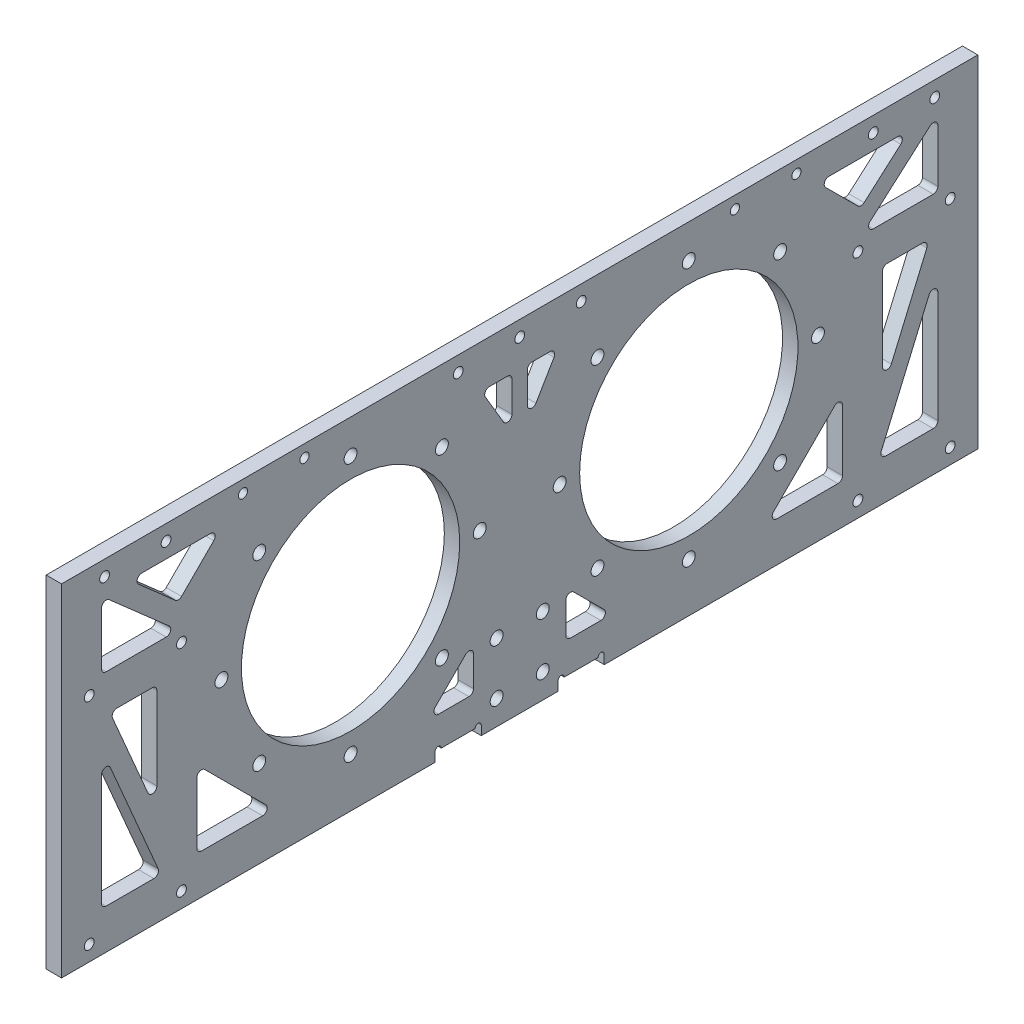
from build123d import *

# Parameters (mm, degrees)
SKETCH_1_W          = 298
SKETCH_1_H          = 111
SKETCH_1_R          = 35.5
SKETCH_1_R_2        = 2.1
SKETCH_1_R_3        = 1.5
EXTRUDE_1_DEPTH     = 5
SKETCH_2_R          = 1.6
CUT_EXTRUDE_1_DEPTH = 213.143819142
SKETCH_3_R          = 1.6
CUT_EXTRUDE_2_DEPTH = 10
CUT_EXTRUDE_3_DEPTH = 213.143819142
CUT_EXTRUDE_4_DEPTH = 213.143819142


with BuildPart() as part:
    # 草图1 → 凸台-拉伸1 (new body)
    with BuildSketch(Plane(origin=(0, 0, 0), x_dir=(0, 0, -1), z_dir=(1, 0, 0))):
        with Locations((55, -2.5)):
            Rectangle(SKETCH_1_W, SKETCH_1_H)
        Circle(SKETCH_1_R, mode=Mode.SUBTRACT)
        with Locations((0, 42)):
            Circle(SKETCH_1_R_2, mode=Mode.SUBTRACT)
        with Locations((110, 42)):
            Circle(SKETCH_1_R_2, mode=Mode.SUBTRACT)
        with Locations((110, 0)):
            Circle(SKETCH_1_R, mode=Mode.SUBTRACT)
        with Locations((62.5, -33)):
            Circle(SKETCH_1_R_2, mode=Mode.SUBTRACT)
        with Locations((47.5, -33)):
            Circle(SKETCH_1_R_2, mode=Mode.SUBTRACT)
        with Locations((47.5, -50)):
            Circle(SKETCH_1_R_2, mode=Mode.SUBTRACT)
        with Locations((62.5, -50)):
            Circle(SKETCH_1_R_2, mode=Mode.SUBTRACT)
        with Locations((-15, 49)):
            Circle(SKETCH_1_R_3, mode=Mode.SUBTRACT)
        with Locations((-35, 49)):
            Circle(SKETCH_1_R_3, mode=Mode.SUBTRACT)
        with Locations((125, 49)):
            Circle(SKETCH_1_R_3, mode=Mode.SUBTRACT)
        with Locations((145, 49)):
            Circle(SKETCH_1_R_3, mode=Mode.SUBTRACT)
        with Locations((29.69848481, 29.69848481)):
            Circle(SKETCH_1_R_2, mode=Mode.SUBTRACT)
        with Locations((42, 0)):
            Circle(SKETCH_1_R_2, mode=Mode.SUBTRACT)
        with Locations((29.69848481, -29.69848481)):
            Circle(SKETCH_1_R_2, mode=Mode.SUBTRACT)
        with Locations((0, -42)):
            Circle(SKETCH_1_R_2, mode=Mode.SUBTRACT)
        with Locations((-29.69848481, -29.69848481)):
            Circle(SKETCH_1_R_2, mode=Mode.SUBTRACT)
        with Locations((-42, 0)):
            Circle(SKETCH_1_R_2, mode=Mode.SUBTRACT)
        with Locations((-29.69848481, 29.69848481)):
            Circle(SKETCH_1_R_2, mode=Mode.SUBTRACT)
        with Locations((139.69848481, 29.69848481)):
            Circle(SKETCH_1_R_2, mode=Mode.SUBTRACT)
        with Locations((152, 0)):
            Circle(SKETCH_1_R_2, mode=Mode.SUBTRACT)
        with Locations((139.69848481, -29.69848481)):
            Circle(SKETCH_1_R_2, mode=Mode.SUBTRACT)
        with Locations((110, -42)):
            Circle(SKETCH_1_R_2, mode=Mode.SUBTRACT)
        with Locations((80.30151519, -29.69848481)):
            Circle(SKETCH_1_R_2, mode=Mode.SUBTRACT)
        with Locations((68, 0)):
            Circle(SKETCH_1_R_2, mode=Mode.SUBTRACT)
        with Locations((80.30151519, 29.69848481)):
            Circle(SKETCH_1_R_2, mode=Mode.SUBTRACT)
    extrude(amount=EXTRUDE_1_DEPTH)

    # 草图2 → 切除-拉伸1 (cut, through all)
    with BuildSketch(Plane(origin=(5, 0, 0), x_dir=(0, 0, -1), z_dir=(1, 0, 0))):
        with Locations((-80, 48)):
            Circle(SKETCH_2_R)
        with Locations((-60, 48)):
            Circle(SKETCH_2_R)
        with Locations((170, 48)):
            Circle(SKETCH_2_R)
        with Locations((190, 48)):
            Circle(SKETCH_2_R)
        with Locations((35, 48)):
            Circle(SKETCH_2_R)
        with Locations((55, 48)):
            Circle(SKETCH_2_R)
        with Locations((75, 48)):
            Circle(SKETCH_2_R)
    extrude(amount=-CUT_EXTRUDE_1_DEPTH, mode=Mode.SUBTRACT)

    # 草图3 → 切除-拉伸2 (cut)
    with BuildSketch(Plane(origin=(5, 0, 0), x_dir=(0, 0, -1), z_dir=(1, 0, 0))):
        with Locations((-85, -53)):
            Circle(SKETCH_3_R)
        with Locations((-55, -53)):
            Circle(SKETCH_3_R)
        with Locations((-85, 17)):
            Circle(SKETCH_3_R)
        with Locations((-55, 17)):
            Circle(SKETCH_3_R)
        with Locations((165, 17)):
            Circle(SKETCH_3_R)
        with Locations((195, 17)):
            Circle(SKETCH_3_R)
        with Locations((165, -53)):
            Circle(SKETCH_3_R)
        with Locations((195, -53)):
            Circle(SKETCH_3_R)
    extrude(amount=-CUT_EXTRUDE_2_DEPTH, mode=Mode.SUBTRACT)

    # 草图4 → 切除-拉伸3 (cut, through all)
    with BuildSketch(Plane(origin=(5, 0, 0), x_dir=(0, 0, -1), z_dir=(1, 0, 0))):
        with BuildLine():
            Line((45.122624964, 39), (51, 39))
            ThreePointArc((51, 39), (52.060660172, 38.560660172), (52.5, 37.5))
            Line((52.5, 37.5), (52.5, 27.508462438))
            ThreePointArc((52.5, 27.508462438), (51.394111669, 26.061162887), (49.707098677, 26.747932249))
            Line((49.707098677, 26.747932249), (43.829723641, 36.73946981))
            ThreePointArc((43.829723641, 36.73946981), (43.820550603, 38.244716293), (45.122624964, 39))
        make_face()
        with BuildLine():
            Line((57.5, 37.5), (57.5, 27.508462438))
            ThreePointArc((57.5, 27.508462438), (58.605888331, 26.061162887), (60.292901323, 26.747932249))
            Line((60.292901323, 26.747932249), (66.170276359, 36.73946981))
            ThreePointArc((66.170276359, 36.73946981), (66.179449397, 38.244716293), (64.877375036, 39))
            Line((64.877375036, 39), (59, 39))
            ThreePointArc((59, 39), (57.939339828, 38.560660172), (57.5, 37.5))
        make_face()
        with BuildLine():
            Line((-81, -7.256992992), (-81, -43.5))
            ThreePointArc((-81, -43.5), (-80.560660172, -44.560660172), (-79.5, -45))
            Line((-79.5, -45), (-63.967282711, -45))
            ThreePointArc((-63.967282711, -45), (-62.715021073, -44.325736513), (-62.588565166, -42.909121052))
            Line((-62.588565166, -42.909121052), (-78.121282455, -6.666114044))
            ThreePointArc((-78.121282455, -6.666114044), (-79.801598808, -5.787626408), (-81, -7.256992992))
        make_face()
        with BuildLine():
            Line((-76.032717289, 9), (-64.5, 9))
            ThreePointArc((-64.5, 9), (-63.439339828, 8.560660172), (-63, 7.5))
            Line((-63, 7.5), (-63, -19.409673675))
            ThreePointArc((-63, -19.409673675), (-64.198401192, -20.879040259), (-65.878717545, -20.000552622))
            Line((-65.878717545, -20.000552622), (-77.411434834, 6.909121052))
            ThreePointArc((-77.411434834, 6.909121052), (-77.284978927, 8.325736513), (-76.032717289, 9))
        make_face()
        with BuildLine():
            Line((-50, -23.621320344), (-50, -43.5))
            ThreePointArc((-50, -43.5), (-49.560660172, -44.560660172), (-48.5, -45))
            Line((-48.5, -45), (-28.621320344, -45))
            ThreePointArc((-28.621320344, -45), (-27.235501045, -44.074025149), (-27.560660172, -42.439339828))
            Line((-27.560660172, -42.439339828), (-47.439339828, -22.560660172))
            ThreePointArc((-47.439339828, -22.560660172), (-49.074025149, -22.235501045), (-50, -23.621320344))
        make_face()
        with BuildLine():
            Line((-81, 39.681900903), (-81, 22.5))
            ThreePointArc((-81, 22.5), (-80.560660172, 21.439339828), (-79.5, 21))
            Line((-79.5, 21), (-59.97511261, 21))
            ThreePointArc((-59.97511261, 21), (-58.571705076, 21.970427254), (-58.984170767, 23.626070275))
            Line((-58.984170767, 23.626070275), (-78.509058158, 40.807971179))
            ThreePointArc((-78.509058158, 40.807971179), (-80.117894504, 41.048724367), (-81, 39.681900903))
        make_face()
        with BuildLine():
            Line((-67.942618769, 43), (-45.539051722, 43))
            ThreePointArc((-45.539051722, 43), (-44.153232424, 42.074025149), (-44.478391551, 40.439339828))
            Line((-44.478391551, 40.439339828), (-54.965167615, 29.952563764))
            ThreePointArc((-54.965167615, 29.952563764), (-55.978028396, 29.513985723), (-57.016769629, 29.88715366))
            Line((-57.016769629, 29.88715366), (-68.933560611, 40.373929725))
            ThreePointArc((-68.933560611, 40.373929725), (-69.346026303, 42.029572746), (-67.942618769, 43))
        make_face()
        with BuildLine():
            Line((28.621320344, -45), (38.5, -45))
            ThreePointArc((38.5, -45), (39.560660172, -44.560660172), (40, -43.5))
            Line((40, -43.5), (40, -33.621320344))
            ThreePointArc((40, -33.621320344), (39.074025149, -32.235501045), (37.439339828, -32.560660172))
            Line((37.439339828, -32.560660172), (27.560660172, -42.439339828))
            ThreePointArc((27.560660172, -42.439339828), (27.235501045, -44.074025149), (28.621320344, -45))
        make_face()
        with BuildLine():
            Line((72.560660172, -32.560660172), (82.439339828, -42.439339828))
            ThreePointArc((82.439339828, -42.439339828), (82.764498955, -44.074025149), (81.378679656, -45))
            Line((81.378679656, -45), (71.5, -45))
            ThreePointArc((71.5, -45), (70.439339828, -44.560660172), (70, -43.5))
            Line((70, -43.5), (70, -33.621320344))
            ThreePointArc((70, -33.621320344), (70.925974851, -32.235501045), (72.560660172, -32.560660172))
        make_face()
        with BuildLine():
            Line((167.016769629, 29.88715366), (178.933560611, 40.373929725))
            ThreePointArc((178.933560611, 40.373929725), (179.346026303, 42.029572746), (177.942618769, 43))
            Line((177.942618769, 43), (155.539051722, 43))
            ThreePointArc((155.539051722, 43), (154.153232424, 42.074025149), (154.478391551, 40.439339828))
            Line((154.478391551, 40.439339828), (164.965167615, 29.952563764))
            ThreePointArc((164.965167615, 29.952563764), (165.978028396, 29.513985723), (167.016769629, 29.88715366))
        make_face()
        with BuildLine():
            Line((168.984170767, 23.626070275), (188.509058158, 40.807971179))
            ThreePointArc((188.509058158, 40.807971179), (190.117894504, 41.048724367), (191, 39.681900903))
            Line((191, 39.681900903), (191, 22.5))
            ThreePointArc((191, 22.5), (190.560660172, 21.439339828), (189.5, 21))
            Line((189.5, 21), (169.97511261, 21))
            ThreePointArc((169.97511261, 21), (168.571705076, 21.970427254), (168.984170767, 23.626070275))
        make_face()
        with BuildLine():
            Line((137.560660172, -42.439339828), (157.439339828, -22.560660172))
            ThreePointArc((157.439339828, -22.560660172), (159.074025149, -22.235501045), (160, -23.621320344))
            Line((160, -23.621320344), (160, -43.5))
            ThreePointArc((160, -43.5), (159.560660172, -44.560660172), (158.5, -45))
            Line((158.5, -45), (138.621320344, -45))
            ThreePointArc((138.621320344, -45), (137.235501045, -44.074025149), (137.560660172, -42.439339828))
        make_face()
        with BuildLine():
            Line((175.878717545, -20.000552622), (187.411434834, 6.909121052))
            ThreePointArc((187.411434834, 6.909121052), (187.284978927, 8.325736513), (186.032717289, 9))
            Line((186.032717289, 9), (174.5, 9))
            ThreePointArc((174.5, 9), (173.439339828, 8.560660172), (173, 7.5))
            Line((173, 7.5), (173, -19.409673675))
            ThreePointArc((173, -19.409673675), (174.198401192, -20.879040259), (175.878717545, -20.000552622))
        make_face()
        with BuildLine():
            Line((172.588565166, -42.909121052), (188.121282455, -6.666114044))
            ThreePointArc((188.121282455, -6.666114044), (189.801598808, -5.787626408), (191, -7.256992992))
            Line((191, -7.256992992), (191, -43.5))
            ThreePointArc((191, -43.5), (190.560660172, -44.560660172), (189.5, -45))
            Line((189.5, -45), (173.967282711, -45))
            ThreePointArc((173.967282711, -45), (172.715021073, -44.325736513), (172.588565166, -42.909121052))
        make_face()
    extrude(amount=-CUT_EXTRUDE_3_DEPTH, mode=Mode.SUBTRACT)

    # 草图6 → 切除-拉伸4 (cut, through all)
    with BuildSketch(Plane(origin=(5, 0, 0), x_dir=(0, 0, -1), z_dir=(1, 0, 0))):
        with BuildLine():
            Line((42.5, -58), (42.5, -55))
            ThreePointArc((42.5, -55), (41.5, -54), (40.5, -55))
            Line((40.5, -55), (29.5, -55))
            ThreePointArc((29.5, -55), (28.5, -54), (27.5, -55))
            Line((27.5, -55), (27.5, -58))
            Line((27.5, -58), (42.5, -58))
        make_face()
        with BuildLine():
            Line((82.5, -58), (67.5, -58))
            Line((67.5, -58), (67.5, -55))
            ThreePointArc((67.5, -55), (68.5, -54), (69.5, -55))
            Line((69.5, -55), (80.5, -55))
            ThreePointArc((80.5, -55), (81.5, -54), (82.5, -55))
            Line((82.5, -55), (82.5, -58))
        make_face()
    extrude(amount=-CUT_EXTRUDE_4_DEPTH, mode=Mode.SUBTRACT)


solid = part.part
